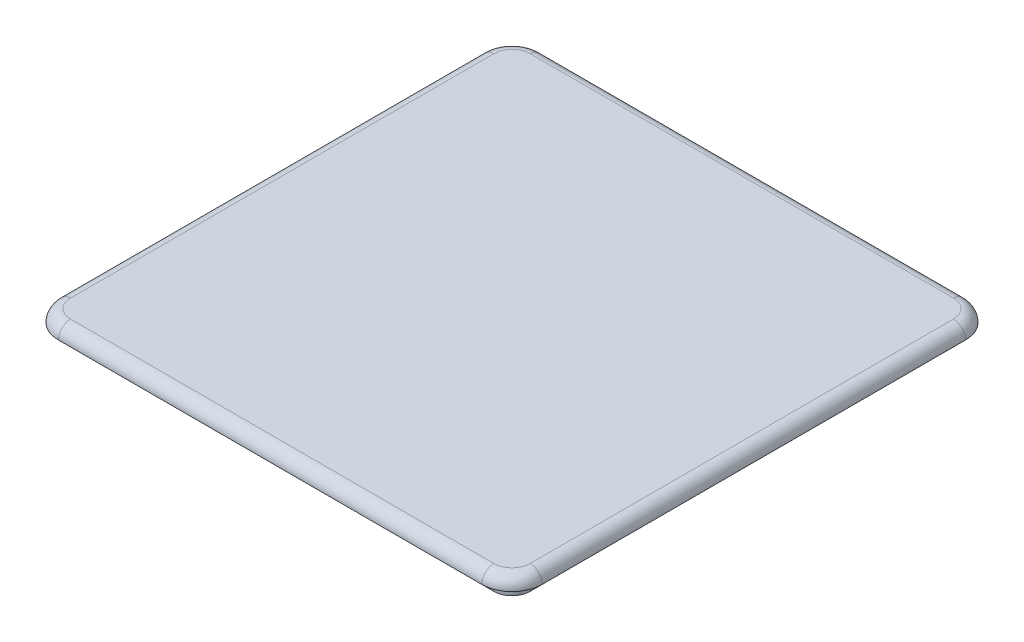
from build123d import *

# Parameters (mm, degrees)
BOSS_EXTRUDE1_DEPTH = 2.54
BOSS_EXTRUDE2_DEPTH = 2.54
FILLET1_R           = 2.54


with BuildPart() as part:
    # Sketch1 → Boss-Extrude1 (new body)
    with BuildSketch(Plane(origin=(0, 0, 0), x_dir=(1, 0, 0), z_dir=(0, 1, 0))):
        with BuildLine():
            Line((-44.45, 50.8), (44.45, 50.8))
            ThreePointArc((44.45, 50.8), (48.940128061, 48.940128061), (50.8, 44.45))
            Line((50.8, 44.45), (50.8, -44.45))
            ThreePointArc((50.8, -44.45), (48.940128061, -48.940128061), (44.45, -50.8))
            Line((44.45, -50.8), (-44.45, -50.8))
            ThreePointArc((-44.45, -50.8), (-48.940128061, -48.940128061), (-50.8, -44.45))
            Line((-50.8, -44.45), (-50.8, 44.45))
            ThreePointArc((-50.8, 44.45), (-48.940128061, 48.940128061), (-44.45, 50.8))
        make_face()
    extrude(amount=BOSS_EXTRUDE1_DEPTH)

    # Sketch2 → Boss-Extrude2 (add)
    with BuildSketch(Plane.XZ):
        with BuildLine():
            Line((-48.26, 44.45), (-48.26, -44.45))
            ThreePointArc((-48.26, -44.45), (-47.144076836, -47.144076836), (-44.45, -48.26))
            Line((-44.45, -48.26), (44.45, -48.26))
            ThreePointArc((44.45, -48.26), (47.144076836, -47.144076836), (48.26, -44.45))
            Line((48.26, -44.45), (48.26, 44.45))
            ThreePointArc((48.26, 44.45), (47.144076836, 47.144076836), (44.45, 48.26))
            Line((44.45, 48.26), (-44.45, 48.26))
            ThreePointArc((-44.45, 48.26), (-47.144076836, 47.144076836), (-48.26, 44.45))
        make_face()
    extrude(amount=BOSS_EXTRUDE2_DEPTH)

    # Fillet1
    fillet1_edges = [part.edges().sort_by_distance(p)[0] for p in [
        (48.940128061, 2.54, -48.940128061),
        (50.8, 2.54, 0),
        (48.940128061, 2.54, 48.940128061),
        (0, 2.54, 50.8),
        (-48.940128061, 2.54, 48.940128061),
        (-50.8, 2.54, 0),
        (-48.940128061, 2.54, -48.940128061),
        (0, 2.54, -50.8),
    ]]
    fillet(fillet1_edges, radius=FILLET1_R - 0.0001)  # a hair under: the kernel refuses the full size


solid = part.part
